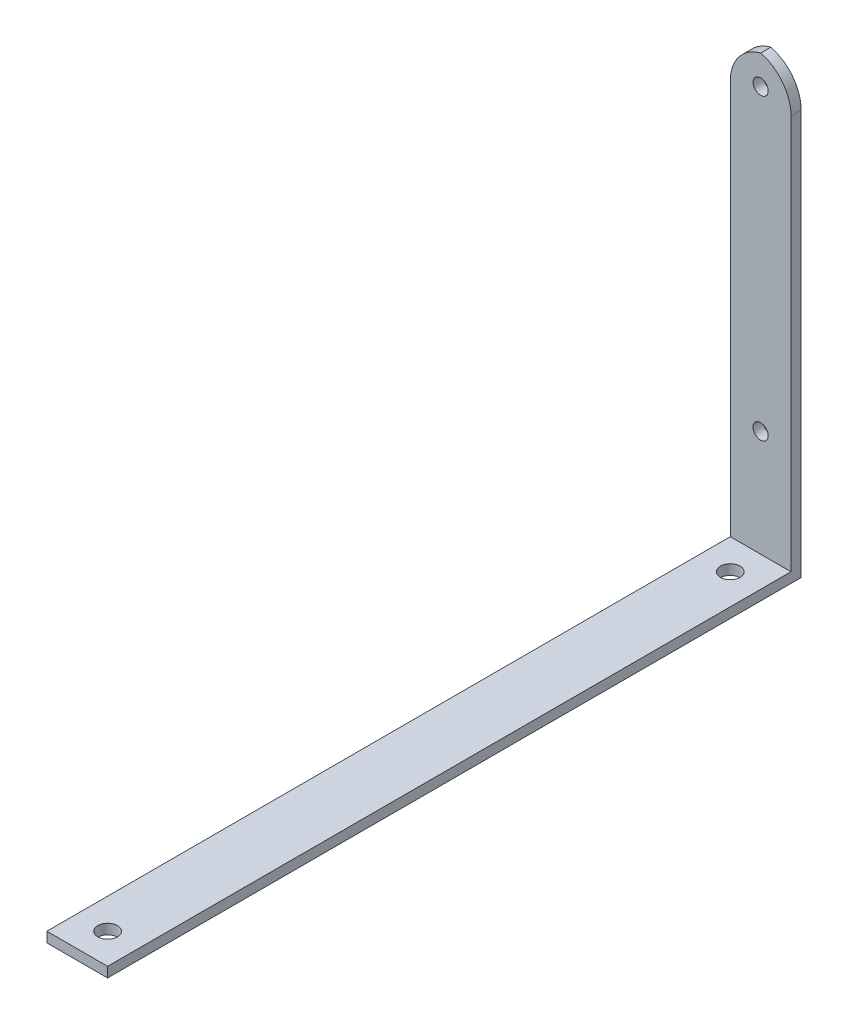
from build123d import *

# Parameters (mm, degrees)
SKETCH1_W           = 12
SKETCH1_H           = 88
SKETCH1_R           = 1.5
BOSS_EXTRUDE1_DEPTH = 2
SKETCH2_W           = 12
SKETCH2_H           = 2
BOSS_EXTRUDE2_DEPTH = 135
FILLET1_R           = 8
SKETCH3_R           = 1.939400698
CUT_EXTRUDE1_DEPTH  = 163.065945849


with BuildPart() as part:
    # Sketch1 → Boss-Extrude1 (new body)
    with BuildSketch(Plane.XY):
        with Locations((6, 44)):
            Rectangle(SKETCH1_W, SKETCH1_H)
        with Locations((6, 82)):
            Circle(SKETCH1_R, mode=Mode.SUBTRACT)
        with Locations((6, 23)):
            Circle(SKETCH1_R, mode=Mode.SUBTRACT)
    extrude(amount=BOSS_EXTRUDE1_DEPTH)

    # Sketch2 → Boss-Extrude2 (add)
    with BuildSketch(Plane.XY.offset(2)):
        with Locations((6, 1)):
            Rectangle(SKETCH2_W, SKETCH2_H)
    extrude(amount=BOSS_EXTRUDE2_DEPTH)

    # Fillet1
    # the kernel refuses this fillet: 8 mm, written as the material it takes off along each edge
    with BuildSketch(Plane(origin=(12, 88, -20), x_dir=(-1, 0, 0), z_dir=(0, 0, 1))) as fillet1_piece_1:
        with BuildLine():
            CenterArc((FILLET1_R, FILLET1_R), FILLET1_R, 180, 90)
            Line((0, FILLET1_R), (0, 0))
            Line((0, 0), (FILLET1_R, 0))
        make_face()
    extrude(amount=42, mode=Mode.SUBTRACT)
    with BuildSketch(Plane(origin=(0, 88, -20), x_dir=(1, 0, 0), z_dir=(0, 0, 1))) as fillet1_piece_2:
        with BuildLine():
            CenterArc((FILLET1_R, -FILLET1_R), FILLET1_R, 90, 90)
            Line((0, -FILLET1_R), (0, 0))
            Line((0, 0), (FILLET1_R, 0))
        make_face()
    extrude(amount=42, mode=Mode.SUBTRACT)

    # Sketch3 → Cut-Extrude1 (cut, through all)
    with BuildSketch(Plane(origin=(0, 2, 0), x_dir=(1, 0, 0), z_dir=(0, 1, 0))):
        with Locations(Location((6, -131, 0), (0, 0, 270))):
            Circle(SKETCH3_R)
        with Locations(Location((6, -8, 0), (0, 0, 270))):
            Circle(SKETCH3_R)
    extrude(amount=-CUT_EXTRUDE1_DEPTH, mode=Mode.SUBTRACT)


solid = part.part
